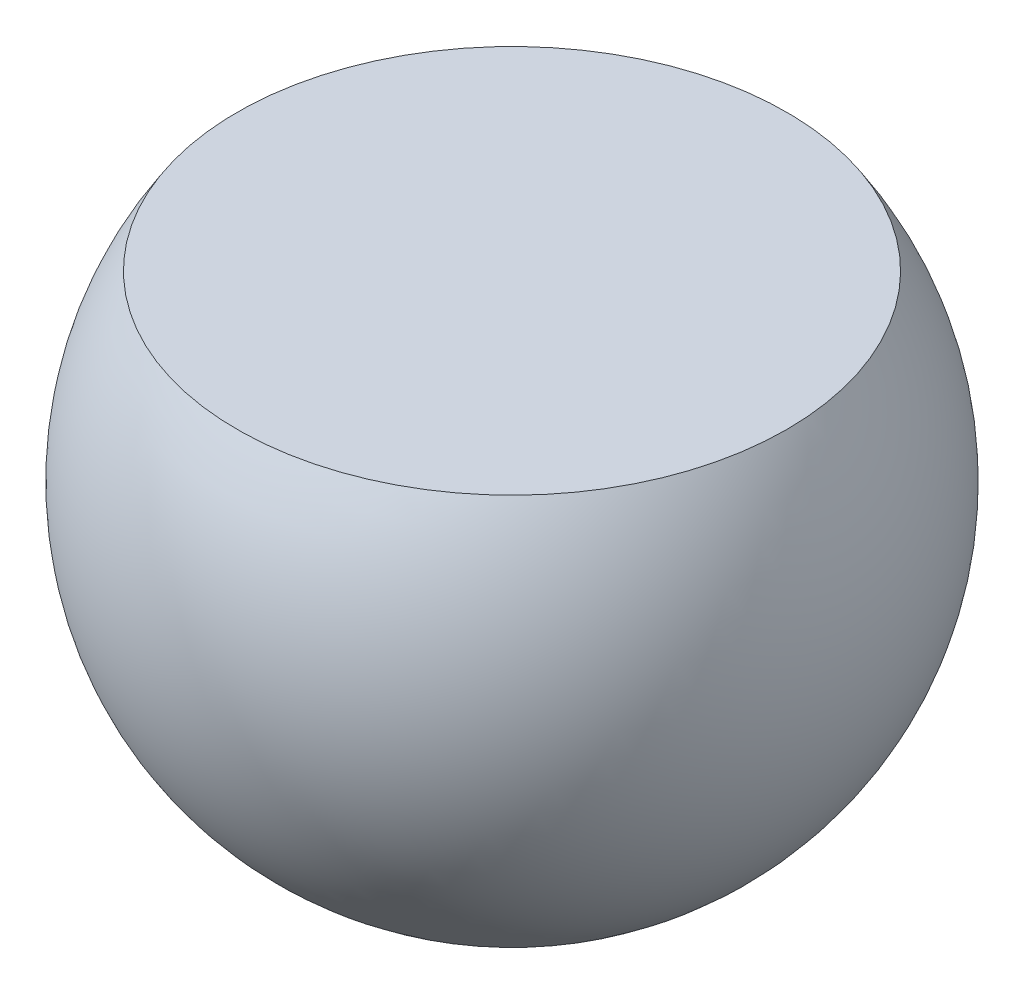
from build123d import *
from OCP.BRepAlgoAPI import BRepAlgoAPI_Cut
from OCP.TopTools import TopTools_ListOfShape

# Parameters (mm, degrees)
SKETCH2_W          = 408.49124402
SKETCH2_H          = 323.52250017
CUT_EXTRUDE1_DEPTH = 68.1736
SKETCH3_W          = 76.2
SKETCH3_H          = 76.2
CUT_EXTRUDE2_DEPTH = 38.1
SKETCH5_W          = 393.276963666
SKETCH5_H          = 361.967680156
CUT_EXTRUDE4_DEPTH = 29.21


with BuildPart() as part:
    # Sketch1 → Revolve1 (revolve)
    with BuildSketch(Plane.XY):
        with BuildLine():
            Line((0, 152.4), (0, -152.4))
            ThreePointArc((0, -152.4), (152.4, 0), (0, 152.4))
        make_face()
    revolve(axis=Axis((0, 152.4, 0), (0, -1, 0)))

    # Sketch2 → Cut-Extrude1 (cut)
    with BuildSketch(Plane(origin=(0, 152.4, 0), x_dir=(1, 0, 0), z_dir=(0, 1, 0))):
        Rectangle(SKETCH2_W, SKETCH2_H)
    extrude(amount=-CUT_EXTRUDE1_DEPTH, mode=Mode.SUBTRACT)


with BuildPart() as cut_extrude2_tool:
    # Sketch3 → Cut-Extrude2 (new body)
    with BuildSketch(Plane(origin=(0, -152.4, 0), x_dir=(-1, 0, 0), z_dir=(0, -1, 0))):
        Rectangle(SKETCH3_W, SKETCH3_H)
    extrude(amount=-CUT_EXTRUDE2_DEPTH)


with BuildPart() as part_1:
    add(part.part)

    # Cut-Extrude2: cut by cut_extrude2_tool, with a tolerance
    cut_extrude2_stock = TopTools_ListOfShape()
    cut_extrude2_stock.Append(part_1.part.wrapped)
    cut_extrude2_tools = TopTools_ListOfShape()
    cut_extrude2_tools.Append(cut_extrude2_tool.part.wrapped)
    cut_extrude2_cut = BRepAlgoAPI_Cut()
    cut_extrude2_cut.SetArguments(cut_extrude2_stock)
    cut_extrude2_cut.SetTools(cut_extrude2_tools)
    cut_extrude2_cut.SetFuzzyValue(0.00001)
    cut_extrude2_cut.Build()
    add(Compound.cast(cut_extrude2_cut.Shape()).solids(), mode=Mode.REPLACE)

    # Sketch5 → Cut-Extrude4 (cut)
    with BuildSketch(Plane(origin=(0, -152.4, 0), x_dir=(-1, 0, 0), z_dir=(0, -1, 0))):
        Rectangle(SKETCH5_W, SKETCH5_H)
    extrude(amount=-CUT_EXTRUDE4_DEPTH, mode=Mode.SUBTRACT)


solid = part_1.part
